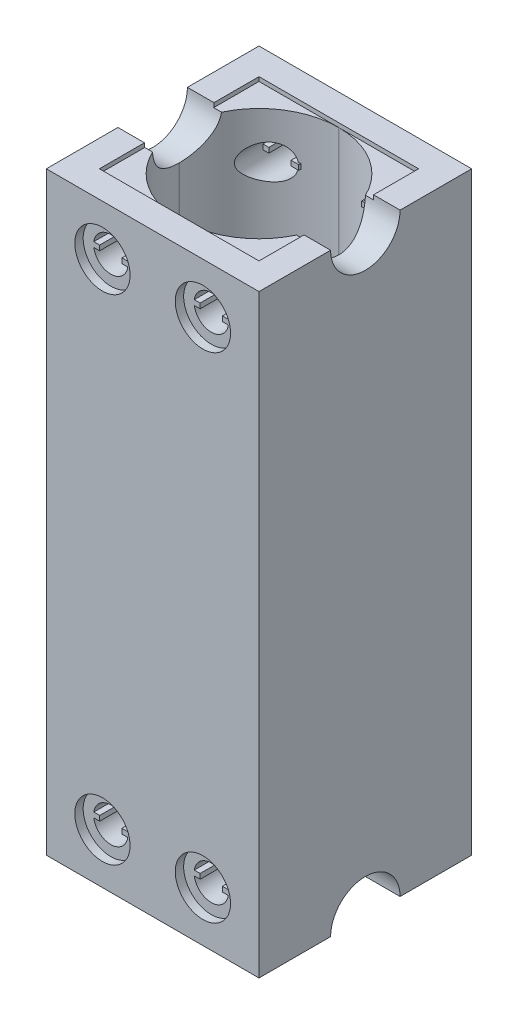
from build123d import *
from build123d.topology import SkipClean

# Parameters (mm, degrees)
SKETCH1_W           = 25.4
SKETCH1_H           = 25.4
SKETCH1_W_2         = 19.05
SKETCH1_H_2         = 19.05
BOSS_EXTRUDE1_DEPTH = 35.5
SKETCH2_R           = 2.05
CUT_EXTRUDE1_DEPTH  = 46.460972273
CUT_EXTRUDE2_DEPTH  = 46.460972273
FILLET1_START       = -9.525
FILLET1_OUTLINE_W   = 19.05
FILLET1_OUTLINE_H   = 71
FILLET1_OUTLINE_R   = 2.05
FILLET1_DEPTH       = 9.5000001
FILLET1_START_2     = 0.0249999
FILLET1_2_OUTLINE_W = 19.05
FILLET1_2_OUTLINE_H = 71
FILLET1_2_OUTLINE_R = 2.05
FILLET1_2_DEPTH     = 9.5000001
FILLET1_3_DEPTH     = 19.05
FILLET1_START_3     = -0.025
FILLET1_4_DEPTH     = 0.0499999
FILLET1_START_4     = -35.5
FILLET1_5_DEPTH     = 71
SKETCH7_W           = 19.06
SKETCH7_H           = 19.06
CUT_EXTRUDE4_DEPTH  = 0.5
SKETCH4_R           = 1.175
CUT_EXTRUDE5_DEPTH  = 2.4
CUT_EXTRUDE8_DEPTH  = 2.4
BOSS_EXTRUDE3_DEPTH = 3.4
SKETCH16_R          = 3.3
CUT_EXTRUDE9_DEPTH  = 1


with BuildPart() as part:
    # Sketch1 → Boss-Extrude1 (new, symmetric)
    with BuildSketch(Plane(origin=(0, 0, 0), x_dir=(1, 0, 0), z_dir=(0, 1, 0))):
        Rectangle(SKETCH1_W, SKETCH1_H)
        Rectangle(SKETCH1_W_2, SKETCH1_H_2, mode=Mode.SUBTRACT)
    extrude(amount=BOSS_EXTRUDE1_DEPTH, both=True)

    # Sketch2 → Cut-Extrude1 (cut, through all)
    with BuildSketch(Plane(origin=(0, 0, 12.7), x_dir=(-1, 0, 0), z_dir=(0, 0, -1))):
        with Locations((-6, 29.5)):
            Circle(SKETCH2_R)
        with Locations((6, 29.5)):
            Circle(SKETCH2_R)
    cut_extrude1 = extrude(amount=CUT_EXTRUDE1_DEPTH, mode=Mode.SUBTRACT)

    # Sketch3 → Cut-Extrude2 (cut, through all)
    with BuildSketch(Plane(origin=(12.7, 0, 0), x_dir=(0, 0, -1), z_dir=(1, 0, 0))):
        with BuildLine():
            Line((-4.15, -35.5), (4.15, -35.5))
            ThreePointArc((4.15, -35.5), (0, -31.35), (-4.15, -35.5))
        make_face()
    cut_extrude2 = extrude(amount=-CUT_EXTRUDE2_DEPTH, mode=Mode.SUBTRACT)

    # Mirror2: Cut-Extrude1, Cut-Extrude2 across plane
    add(cut_extrude1.mirror(Plane.ZX), mode=Mode.SUBTRACT)
    add(cut_extrude2.mirror(Plane.ZX), mode=Mode.SUBTRACT)

    # Fillet1: read off the stored shape, not the designer's step
    # Fillet1 outline → Fillet1 (add)
    with SkipClean():  # the faces are left unmerged after this step: merging them gives an invalid solid
        with BuildSketch(Plane.XY.offset(FILLET1_START)):
            Rectangle(FILLET1_OUTLINE_W, FILLET1_OUTLINE_H)
            with Locations((-6, -29.5)):
                Circle(FILLET1_OUTLINE_R, mode=Mode.SUBTRACT)
            with Locations((6, -29.5)):
                Circle(FILLET1_OUTLINE_R, mode=Mode.SUBTRACT)
            with Locations((-6, 29.5)):
                Circle(FILLET1_OUTLINE_R, mode=Mode.SUBTRACT)
            with Locations((6, 29.5)):
                Circle(FILLET1_OUTLINE_R, mode=Mode.SUBTRACT)
        extrude(amount=FILLET1_DEPTH)
    add(part.part.scale(1), mode=Mode.REPLACE)  # the faces are merged on a copy

    # Fillet1 2 outline → Fillet1 2 (add)
    with SkipClean():  # the faces are left unmerged after this step: merging them gives an invalid solid
        with BuildSketch(Plane.XY.offset(FILLET1_START_2)):
            Rectangle(FILLET1_2_OUTLINE_W, FILLET1_2_OUTLINE_H)
            with Locations((-6, -29.5)):
                Circle(FILLET1_2_OUTLINE_R, mode=Mode.SUBTRACT)
            with Locations((6, -29.5)):
                Circle(FILLET1_2_OUTLINE_R, mode=Mode.SUBTRACT)
            with Locations((-6, 29.5)):
                Circle(FILLET1_2_OUTLINE_R, mode=Mode.SUBTRACT)
            with Locations((6, 29.5)):
                Circle(FILLET1_2_OUTLINE_R, mode=Mode.SUBTRACT)
        extrude(amount=FILLET1_2_DEPTH)

    # Fillet1 3 outline → Fillet1 3 (cut)
    with SkipClean():  # the faces are left unmerged after this step: merging them gives an invalid solid
        with BuildSketch(Plane.YZ.offset(FILLET1_START)):
            with BuildLine():
                ThreePointArc((31.350075301, -0.0249999), (32.574359009, -2.94331867), (35.5, -4.15))
                Line((35.5, -4.15), (35.5, -0.0249999))
                Line((35.5, -0.0249999), (31.350075301, -0.0249999))
            make_face()
            with BuildLine():
                Line((-35.5, -0.0249999), (-35.5, -4.15))
                ThreePointArc((-35.5, -4.15), (-32.574359009, -2.94331867), (-31.350075301, -0.0249999))
                Line((-31.350075301, -0.0249999), (-35.5, -0.0249999))
            make_face()
            with BuildLine():
                ThreePointArc((35.5, 4.15), (32.574359009, 2.94331867), (31.350075301, 0.0249999))
                Line((31.350075301, 0.0249999), (35.5, 0.0249999))
                Line((35.5, 0.0249999), (35.5, 4.15))
            make_face()
            with BuildLine():
                Line((-35.5, 0.0249999), (-31.350075301, 0.0249999))
                ThreePointArc((-31.350075301, 0.0249999), (-32.574359009, 2.94331867), (-35.5, 4.15))
                Line((-35.5, 4.15), (-35.5, 0.0249999))
            make_face()
        extrude(amount=FILLET1_3_DEPTH, mode=Mode.SUBTRACT)

    # Fillet1 4 outline → Fillet1 4 (cut)
    with SkipClean():  # the faces are left unmerged after this step: merging them gives an invalid solid
        with BuildSketch(Plane.YZ.offset(FILLET1_START_3)):
            with BuildLine():
                Line((-35.5, -9.525), (35.5, -9.525))
                Line((35.5, -9.525), (35.5, -4.15))
                ThreePointArc((35.5, -4.15), (32.574359009, -2.94331867), (31.350075301, -0.0249999))
                Line((31.350075301, -0.0249999), (-31.350075301, -0.0249999))
                ThreePointArc((-31.350075301, -0.0249999), (-32.574359009, -2.94331867), (-35.5, -4.15))
                Line((-35.5, -4.15), (-35.5, -9.525))
            make_face()
            with BuildLine():
                Line((-31.350075301, 0.0249999), (31.350075301, 0.0249999))
                ThreePointArc((31.350075301, 0.0249999), (32.574359009, 2.94331867), (35.5, 4.15))
                Line((35.5, 4.15), (35.5, 9.525))
                Line((35.5, 9.525), (-35.5, 9.525))
                Line((-35.5, 9.525), (-35.5, 4.15))
                ThreePointArc((-35.5, 4.15), (-32.574359009, 2.94331867), (-31.350075301, 0.0249999))
            make_face()
        extrude(amount=FILLET1_4_DEPTH, mode=Mode.SUBTRACT)

    # Fillet1 5 outline → Fillet1 5 (cut)
    with SkipClean():  # the faces are left unmerged after this step: merging them gives an invalid solid
        with BuildSketch(Plane(origin=(0, 0, 0), x_dir=(1, 0, 0), z_dir=(0, 1, 0)).offset(FILLET1_START_4)):
            with BuildLine():
                Line((-0.025, 0.0249999), (-0.025, 9.525))
                ThreePointArc((-0.025, 9.525), (-6.742514421, 6.742514421), (-9.525, 0.025))
                Line((-9.525, 0.025), (-0.025, 0.0249999))
            make_face()
            with BuildLine():
                Line((-0.025, -0.0249999), (-9.525, -0.025))
                ThreePointArc((-9.525, -0.025), (-6.742514421, -6.742514421), (-0.025, -9.525))
                Line((-0.025, -9.525), (-0.025, -0.0249999))
            make_face()
            with BuildLine():
                Line((0.0249999, -0.0249999), (0.025, -9.525))
                ThreePointArc((0.025, -9.525), (6.742514421, -6.742514421), (9.525, -0.025))
                Line((9.525, -0.025), (0.0249999, -0.0249999))
            make_face()
            with BuildLine():
                Line((0.0249999, 0.0249999), (9.525, 0.025))
                ThreePointArc((9.525, 0.025), (6.742514421, 6.742514421), (0.025, 9.525))
                Line((0.025, 9.525), (0.0249999, 0.0249999))
            make_face()
        extrude(amount=FILLET1_5_DEPTH, mode=Mode.SUBTRACT)

    # Sketch7 → Cut-Extrude4 (cut)
    with SkipClean():  # the faces are left unmerged after this step: merging them gives an invalid solid
        with BuildSketch(Plane(origin=(0, 35.5, 0), x_dir=(1, 0, 0), z_dir=(0, 1, 0))):
            Rectangle(SKETCH7_W, SKETCH7_H)
        extrude(amount=-CUT_EXTRUDE4_DEPTH, mode=Mode.SUBTRACT)

    # Sketch4 → Cut-Extrude5 (cut)
    with SkipClean():  # the faces are left unmerged after this step: merging them gives an invalid solid
        with BuildSketch(Plane(origin=(0, -35.5, 0), x_dir=(1, 0, 0), z_dir=(0, 1, 0))):
            with Locations(Location((7.78, -7.78, 0), (0, 0, 270))):
                Circle(SKETCH4_R)
            with Locations(Location((-7.78, -7.78, 0), (0, 0, 270))):
                Circle(SKETCH4_R)
            with Locations(Location((7.78, 7.78, 0), (0, 0, 270))):
                Circle(SKETCH4_R)
            with Locations(Location((-7.78, 7.78, 0), (0, 0, 270))):
                Circle(SKETCH4_R)
        extrude(amount=CUT_EXTRUDE5_DEPTH, mode=Mode.SUBTRACT)

    # Sketch11 → Cut-Extrude8 (cut)
    with SkipClean():  # the faces are left unmerged after this step: merging them gives an invalid solid
        with BuildSketch(Plane.XZ.offset(35.5)):
            Polygon((-5.18, 6.2788893), (-5.18, 9.2811107), (-7.78, 10.7822214), (-10.38, 9.2811107), (-10.38, 6.2788893), (-7.78, 4.7777786), align=None)
            Polygon((10.38, 6.2788893), (7.78, 4.7777786), (5.18, 6.2788893), (5.18, 9.2811107), (7.78, 10.7822214), (10.38, 9.2811107), align=None)
            Polygon((5.18, -9.2811107), (7.78, -10.7822214), (10.38, -9.2811107), (10.38, -6.2788893), (7.78, -4.7777786), (5.18, -6.2788893), align=None)
            Polygon((-10.38, -6.2788893), (-7.78, -4.7777786), (-5.18, -6.2788893), (-5.18, -9.2811107), (-7.78, -10.7822214), (-10.38, -9.2811107), align=None)
        extrude(amount=-CUT_EXTRUDE8_DEPTH, mode=Mode.SUBTRACT)

    # Sketch13 → Boss-Extrude3 (add)
    with SkipClean():  # the faces are left unmerged after this step: merging them gives an invalid solid
        with BuildSketch(Plane.XY.offset(11.9)):
            Polygon((-8.027929979, 29.8), (-8.244428185, 29.8), (-8.244428185, 29.2), (-7.977371993, 29.2), (-7.327929979, 29.2), (-7.327929979, 29.8), align=None)
            Polygon((-3.972070021, 29.8), (-3.755571815, 29.8), (-3.755571815, 29.2), (-4.022628007, 29.2), (-4.672070021, 29.2), (-4.672070021, 29.8), align=None)
            Polygon((7.327929979, 29.8), (7.327929979, 29.2), (7.977371993, 29.2), (8.244428185, 29.2), (8.244428185, 29.8), (8.027929979, 29.8), align=None)
            Polygon((3.755571815, 29.8), (3.755571815, 29.2), (4.022628007, 29.2), (4.672070021, 29.2), (4.672070021, 29.8), (3.972070021, 29.8), align=None)
            Polygon((3.755571815, -29.2), (4.022628007, -29.2), (4.672070021, -29.2), (4.672070021, -29.8), (3.972070021, -29.8), (3.755571815, -29.8), align=None)
            Polygon((7.977371993, -29.2), (7.327929979, -29.2), (7.327929979, -29.8), (8.027929979, -29.8), (8.244428185, -29.8), (8.244428185, -29.2), align=None)
            Polygon((-4.022628007, -29.2), (-4.672070021, -29.2), (-4.672070021, -29.8), (-3.972070021, -29.8), (-3.755571815, -29.8), (-3.755571815, -29.2), align=None)
            Polygon((-8.244428185, -29.2), (-7.977371993, -29.2), (-7.327929979, -29.2), (-7.327929979, -29.8), (-8.027929979, -29.8), (-8.244428185, -29.8), align=None)
        boss_extrude3 = extrude(amount=-BOSS_EXTRUDE3_DEPTH)

    # Mirror3: Boss-Extrude3 across plane
    with SkipClean():  # the faces are left unmerged after this step: merging them gives an invalid solid
        add(boss_extrude3.mirror(Plane.XY))

    # Sketch16 → Cut-Extrude9 (cut)
    with SkipClean():  # the faces are left unmerged after this step: merging them gives an invalid solid
        with BuildSketch(Plane.XY.offset(12.7)):
            with Locations((-6, 29.5)):
                Circle(SKETCH16_R)
            with Locations((6, 29.5)):
                Circle(SKETCH16_R)
            with Locations((-6, -29.5)):
                Circle(SKETCH16_R)
            with Locations((6, -29.5)):
                Circle(SKETCH16_R)
        cut_extrude9 = extrude(amount=-CUT_EXTRUDE9_DEPTH, mode=Mode.SUBTRACT)

    # Mirror4: Cut-Extrude9 across plane
    with SkipClean():  # the faces are left unmerged after this step: merging them gives an invalid solid
        add(cut_extrude9.mirror(Plane.XY), mode=Mode.SUBTRACT)


solid = part.part
